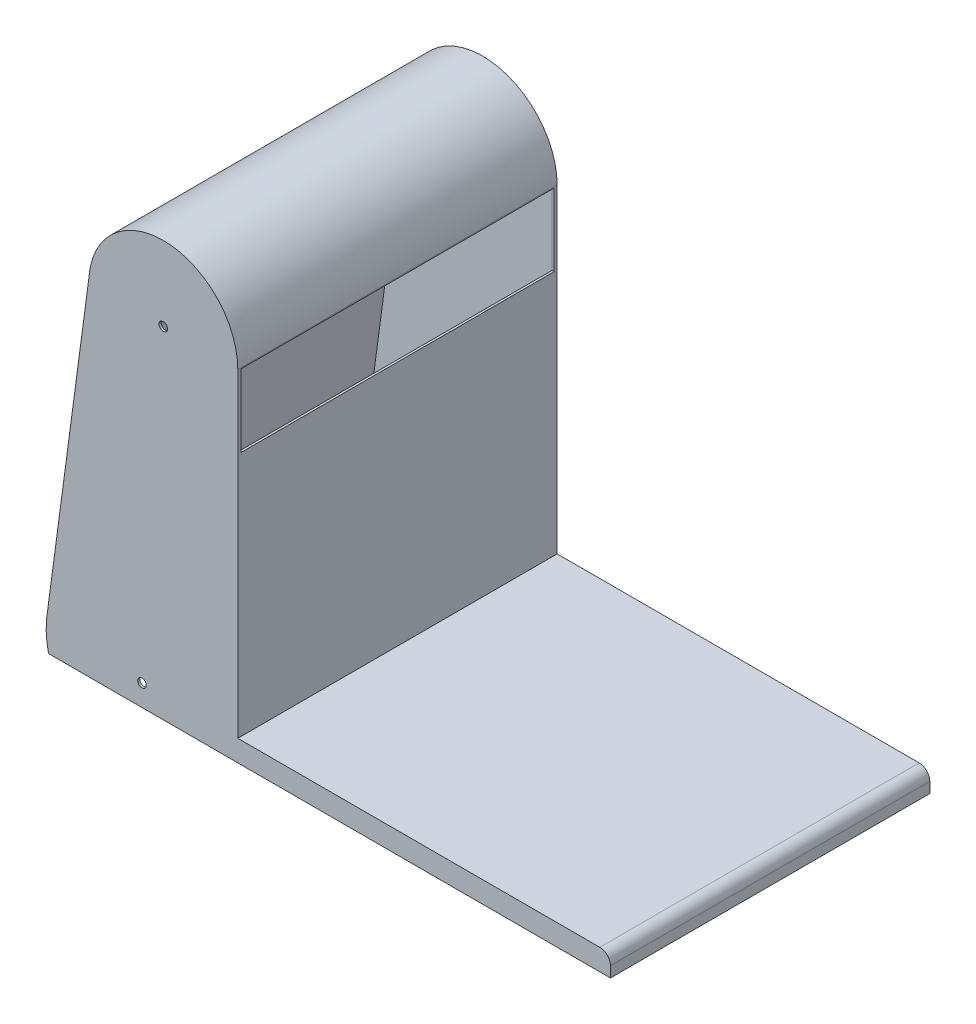
from build123d import *

# Parameters (mm, degrees)
EXTRUDE_1_DEPTH      = 300
FILLET_1_R           = 10
SHELL_START          = -298
SHELL_1_DEPTH        = 296
SKETCH_2_R           = 4
CUT_EXTRUDE_1_DEPTH  = 649.459713475
EXTRUDE_2_DEPTH      = 300
CUT_EXTRUDE_12_DEPTH = 10


# Read off the part's stored shape, not the designer's step: 抽壳1
with BuildPart() as part:
    # 草图1 → 凸台-拉伸1 (new body)
    with BuildSketch(Plane.XY):
        with BuildLine():
            Line((440, -20), (440, 0))
            Line((440, 0), (90, 0))
            Line((90, 0), (90, 300))
            ThreePointArc((90, 300), (22.32945557, 369.961229526), (-49.84496105, 304.656330737))
            Line((-49.84496105, 304.656330737), (-89.800664207, 5.986710947))
            ThreePointArc((-89.800664207, 5.986710947), (-89.720985624, -7.081294982), (-87.749643874, -20))
            Line((-87.749643874, -20), (0, -20))
            Line((0, -20), (400, -20))
            Line((400, -20), (440, -20))
        make_face()
    extrude(amount=-EXTRUDE_1_DEPTH)

    # 圆角1
    fillet_1_edges = [part.edges().sort_by_distance(p)[0] for p in [
        (440, 0, -150),
    ]]
    fillet(fillet_1_edges, radius=FILLET_1_R)

    # 抽壳1 outline → 抽壳1 (cut)
    with BuildSketch(Plane.XY.offset(SHELL_START)):
        with BuildLine():
            Line((88, -2), (88, 300))
            ThreePointArc((88, 300), (22.229935395, 367.963426842), (-47.85374671, 304.45747209))
            Line((-47.85374671, 304.45747209), (-87.809464232, 5.787744921))
            ThreePointArc((-87.809464232, 5.787744921), (-87.706256756, -7.184185814), (-85.697141143, -20))
            Line((-85.697141143, -20), (438, -20))
            Line((438, -20), (438, -10))
            ThreePointArc((438, -10), (435.656854249, -4.343145751), (430, -2))
            Line((430, -2), (88, -2))
        make_face()
    extrude(amount=SHELL_1_DEPTH, mode=Mode.SUBTRACT)

    # 草图2 → 切除-拉伸1 (cut, through all)
    with BuildSketch(Plane.XY):
        Circle(SKETCH_2_R)
        with Locations((20, 300)):
            Circle(SKETCH_2_R)
    extrude(amount=-CUT_EXTRUDE_1_DEPTH, mode=Mode.SUBTRACT)

    # 草图3 → 凸台-拉伸2 (add)
    with BuildSketch(Plane.XY):
        with BuildLine():
            Line((88.022724339, 0), (90, 0))
            ThreePointArc((90, 0), (89.435641521, -10.063102189), (87.749643874, -20))
            Line((87.749643874, -20), (85.720475967, -20))
            ThreePointArc((85.720475967, -20), (87.4452681, -10.066036305), (88.022724339, 0))
        make_face()
    extrude(amount=-EXTRUDE_2_DEPTH)

    # 草图4 → 切除-拉伸12 (cut)
    with BuildSketch(Plane.ZY.offset(-88)):
        Polygon((-7, 231), (-3, 231), (-3, 299), (-7, 299), (-293, 299), (-297, 299), (-297, 231), align=None)
    extrude(amount=-CUT_EXTRUDE_12_DEPTH, mode=Mode.SUBTRACT)


solid = part.part
